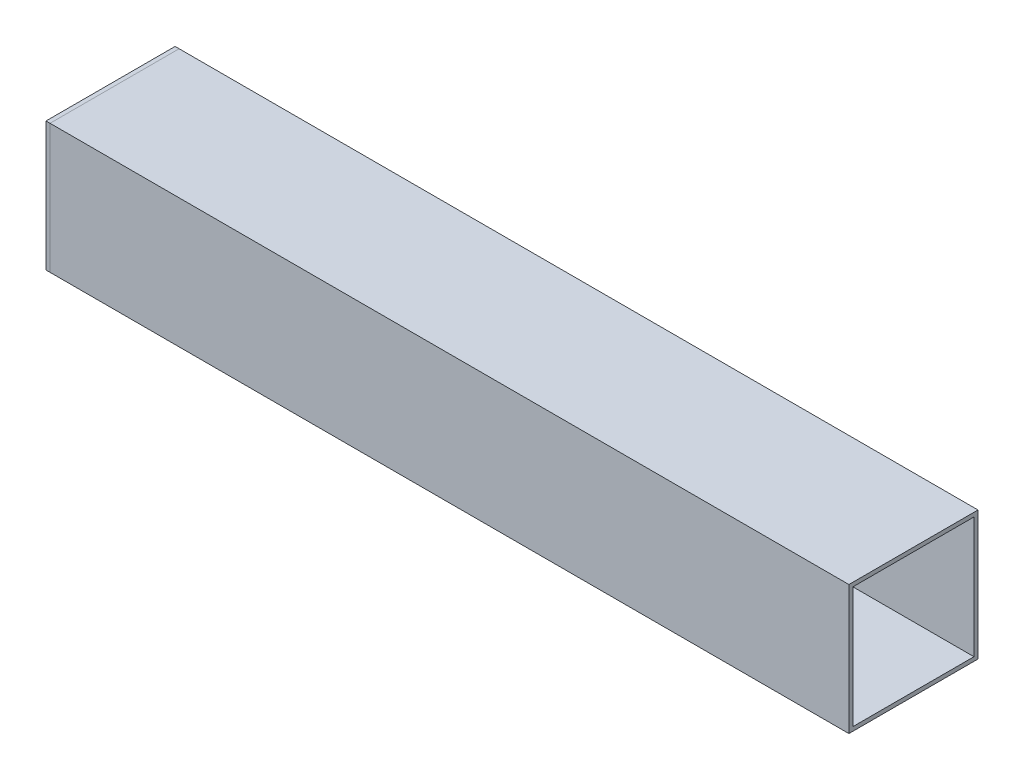
from build123d import *

# Parameters (mm, degrees)
SKETCH1_W           = 101.6
SKETCH1_H           = 101.6
SKETCH1_W_2         = 95.25
SKETCH1_H_2         = 95.25
BOSS_EXTRUDE1_DEPTH = 628.65
SKETCH2_W           = 101.6
SKETCH2_H           = 101.6
BOSS_EXTRUDE2_DEPTH = 3.175


with BuildPart() as part:
    # Sketch1 → Boss-Extrude1 (new body)
    with BuildSketch(Plane(origin=(0, 0, 0), x_dir=(0, 0, -1), z_dir=(1, 0, 0))):
        with Locations((-50.8, 50.8)):
            Rectangle(SKETCH1_W, SKETCH1_H)
        with Locations((-50.8, 50.8)):
            Rectangle(SKETCH1_W_2, SKETCH1_H_2, mode=Mode.SUBTRACT)
    extrude(amount=BOSS_EXTRUDE1_DEPTH)


with BuildPart() as body_2:
    # Sketch2 → Boss-Extrude2 (new body)
    with BuildSketch(Plane.ZY):
        with Locations((50.8, 50.8)):
            Rectangle(SKETCH2_W, SKETCH2_H)
    extrude(amount=BOSS_EXTRUDE2_DEPTH)


solid = Compound([part.part, body_2.part])
